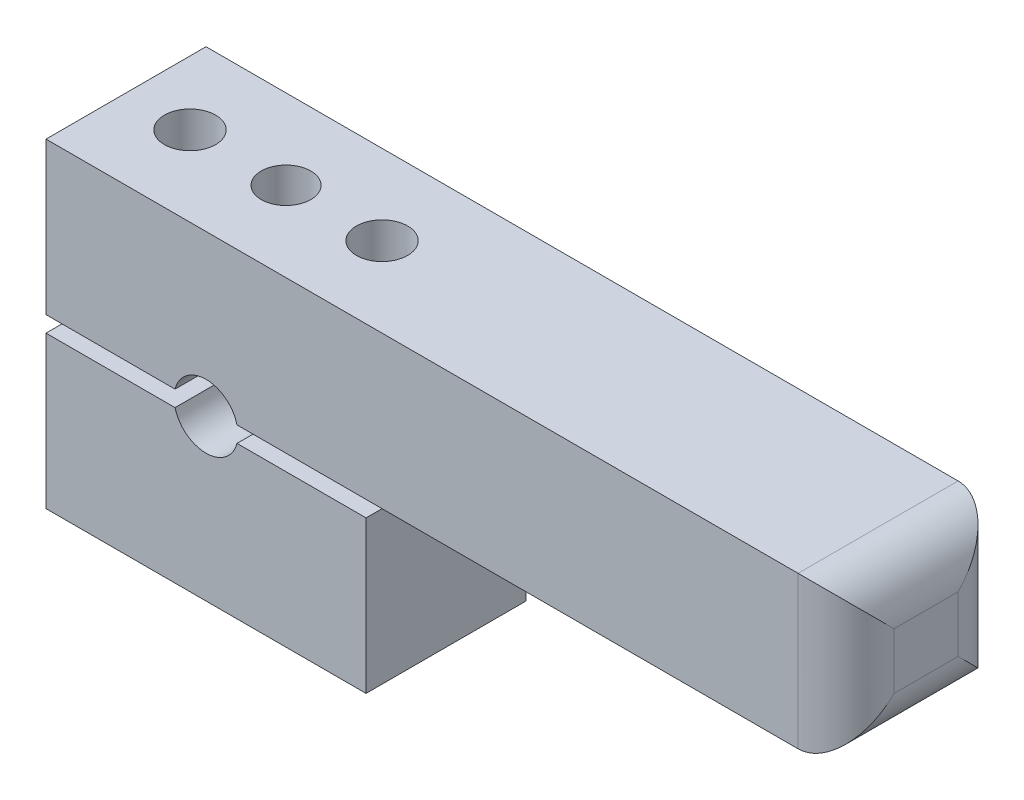
from build123d import *

# Parameters (mm, degrees)
BOSS_EXTRUDE1_DEPTH   = 10
BOSS_EXTRUDE1_2_DEPTH = 10
SKETCH2_R             = 1.6
CUT_EXTRUDE1_DEPTH    = 25.494897428
SKETCH3_R             = 1.55
CUT_EXTRUDE2_DEPTH    = 10
CUT_EXTRUDE3_DEPTH    = 3
SKETCH5_W             = 10
SKETCH5_H             = 9.5
BOSS_EXTRUDE2_DEPTH   = 30
FILLET1_R             = 3


with BuildPart() as part:
    # Sketch1 → Boss-Extrude1 (new body)
    with BuildSketch(Plane.XY):
        with BuildLine():
            Line((-10, -0.5), (-10, -10))
            Line((-10, -10), (10, -10))
            Line((10, -10), (10, -0.5))
            Line((10, -0.5), (1.936491673, -0.5))
            ThreePointArc((1.936491673, -0.5), (0, -2), (-1.936491673, -0.5))
            Line((-1.936491673, -0.5), (-10, -0.5))
        make_face()
    extrude(amount=BOSS_EXTRUDE1_DEPTH)


with BuildPart() as body_2:
    # Sketch1 → Boss-Extrude1 2 (new body)
    with BuildSketch(Plane.XY):
        with BuildLine():
            Line((-10, 10), (-10, 0.5))
            Line((-10, 0.5), (-1.936491673, 0.5))
            ThreePointArc((-1.936491673, 0.5), (0, 2), (1.936491673, 0.5))
            Line((1.936491673, 0.5), (10, 0.5))
            Line((10, 0.5), (10, 10))
            Line((10, 10), (-10, 10))
        make_face()
    extrude(amount=BOSS_EXTRUDE1_2_DEPTH)


with BuildPart() as cut_extrude1_tool:
    # Sketch2 → Cut-Extrude1 (new, through all)
    with BuildSketch(Plane(origin=(0, 10, 0), x_dir=(1, 0, 0), z_dir=(0, 1, 0))):
        with Locations((-6, -5)):
            Circle(SKETCH2_R)
        with Locations((6, -5)):
            Circle(SKETCH2_R)
    extrude(amount=-CUT_EXTRUDE1_DEPTH)


with BuildPart() as part_1:
    add(part.part)

    # Cut-Extrude1: cut by cut_extrude1_tool
    add(cut_extrude1_tool.part, mode=Mode.SUBTRACT)

    # Sketch4 → Cut-Extrude3 (cut)
    with BuildSketch(Plane.XZ.offset(10)):
        Polygon((-4.41228676, 7.75), (-7.58771324, 7.75), (-9.175426481, 5), (-7.58771324, 2.25), (-4.41228676, 2.25), (-2.824573519, 5), align=None)
        Polygon((7.58771324, 7.75), (4.41228676, 7.75), (2.824573519, 5), (4.41228676, 2.25), (7.58771324, 2.25), (9.175426481, 5), align=None)
    extrude(amount=-CUT_EXTRUDE3_DEPTH, mode=Mode.SUBTRACT)


with BuildPart() as body_2_1:
    add(body_2.part)

    # Cut-Extrude1: cut by cut_extrude1_tool
    add(cut_extrude1_tool.part, mode=Mode.SUBTRACT)

    # Sketch3 → Cut-Extrude2 (cut)
    with BuildSketch(Plane(origin=(0, 10, 0), x_dir=(1, 0, 0), z_dir=(0, 1, 0))):
        with Locations((0, -5)):
            Circle(SKETCH3_R)
    extrude(amount=-CUT_EXTRUDE2_DEPTH, mode=Mode.SUBTRACT)

    # Sketch5 → Boss-Extrude2 (add)
    with BuildSketch(Plane(origin=(10, 0, 0), x_dir=(0, 0, -1), z_dir=(1, 0, 0))):
        with Locations((-5, 5.25)):
            Rectangle(SKETCH5_W, SKETCH5_H)
    extrude(amount=BOSS_EXTRUDE2_DEPTH)

    # Fillet1
    fillet1_edges = [body_2_1.edges().sort_by_distance(p)[0] for p in [
        (40, 5.25, 10),
        (40, 10, 5),
        (40, 5.25, 0),
        (40, 0.5, 5),
    ]]
    fillet(fillet1_edges, radius=FILLET1_R)


solid = Compound([part_1.part, body_2_1.part])
